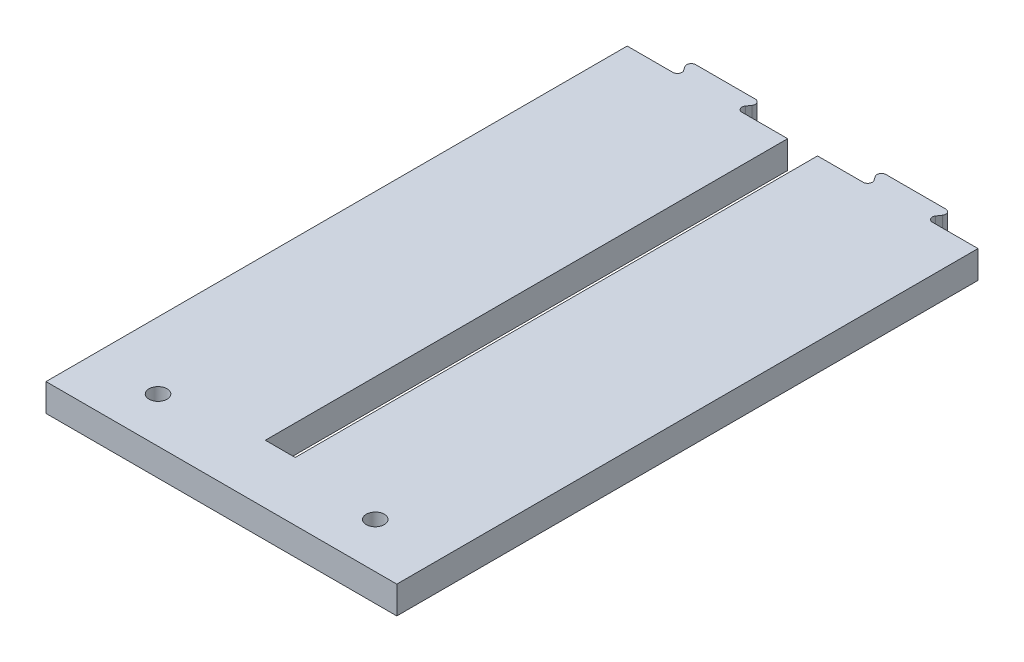
from build123d import *

# Parameters (mm, degrees)
SKETCH1_W           = 38.75
SKETCH1_H           = 72.5
BOSS_EXTRUDE1_DEPTH = 3.05
SKETCH4_W           = 3.3
SKETCH4_H           = 1
SKETCH4_H_2         = 61.8
CUT_EXTRUDE1_DEPTH  = 76.106212293
SKETCH7_R           = 1
CUT_EXTRUDE4_DEPTH  = 76.106212293
SKETCH8_W           = 38.75
SKETCH8_H           = 8.3
CUT_EXTRUDE5_DEPTH  = 76.106212293
BOSS_EXTRUDE3_DEPTH = 3.05
FILLET2_R           = 0.5


with BuildPart() as part:
    # Sketch1 → Boss-Extrude1 (new body)
    with BuildSketch(Plane(origin=(0, 0, 0), x_dir=(1, 0, 0), z_dir=(0, 1, 0))):
        with Locations((0, 36.25)):
            Rectangle(SKETCH1_W, SKETCH1_H)
    extrude(amount=BOSS_EXTRUDE1_DEPTH)

    # Sketch4 → Cut-Extrude1 (cut, through all)
    with BuildSketch(Plane(origin=(0, 3.05, 0), x_dir=(1, 0, 0), z_dir=(0, 1, 0))):
        with Locations((0, 70)):
            Rectangle(SKETCH4_W, SKETCH4_H)
        with Locations((0, 37.4)):
            Rectangle(SKETCH4_W, SKETCH4_H_2)
    extrude(amount=-CUT_EXTRUDE1_DEPTH, mode=Mode.SUBTRACT)

    # Sketch7 → Cut-Extrude4 (cut, through all)
    with BuildSketch(Plane(origin=(0, 3.05, 0), x_dir=(1, 0, 0), z_dir=(0, 1, 0))):
        with Locations((-12, 5)):
            Circle(SKETCH7_R)
        with Locations((12, 5)):
            Circle(SKETCH7_R)
    extrude(amount=-CUT_EXTRUDE4_DEPTH, mode=Mode.SUBTRACT)

    # Sketch8 → Cut-Extrude5 (cut, through all)
    with BuildSketch(Plane(origin=(0, 3.05, 0), x_dir=(1, 0, 0), z_dir=(0, 1, 0))):
        with Locations((0, 68.35)):
            Rectangle(SKETCH8_W, SKETCH8_H)
    extrude(amount=-CUT_EXTRUDE5_DEPTH, mode=Mode.SUBTRACT)

    # Sketch9 → Boss-Extrude3 (add)
    with BuildSketch(Plane(origin=(0, 3.05, 0), x_dir=(1, 0, 0), z_dir=(0, 1, 0))):
        Polygon((-14.7625, 66.2), (-13.375, 64.2), (-7.65, 64.2), (-6.2625, 66.2), align=None)
        Polygon((6.2625, 66.2), (7.65, 64.2), (13.375, 64.2), (14.7625, 66.2), align=None)
    extrude(amount=-BOSS_EXTRUDE3_DEPTH)

    # Fillet2
    fillet2_edges = [part.edges().sort_by_distance(p)[0] for p in [
        (13.375, 1.525, -64.2),
        (-7.65, 1.525, -64.2),
        (14.7625, 1.525, -66.2),
        (7.65, 1.525, -64.2),
        (6.2625, 1.525, -66.2),
        (-6.2625, 1.525, -66.2),
        (-14.7625, 1.525, -66.2),
        (-13.375, 1.525, -64.2),
    ]]
    fillet(fillet2_edges, radius=FILLET2_R)


solid = part.part
